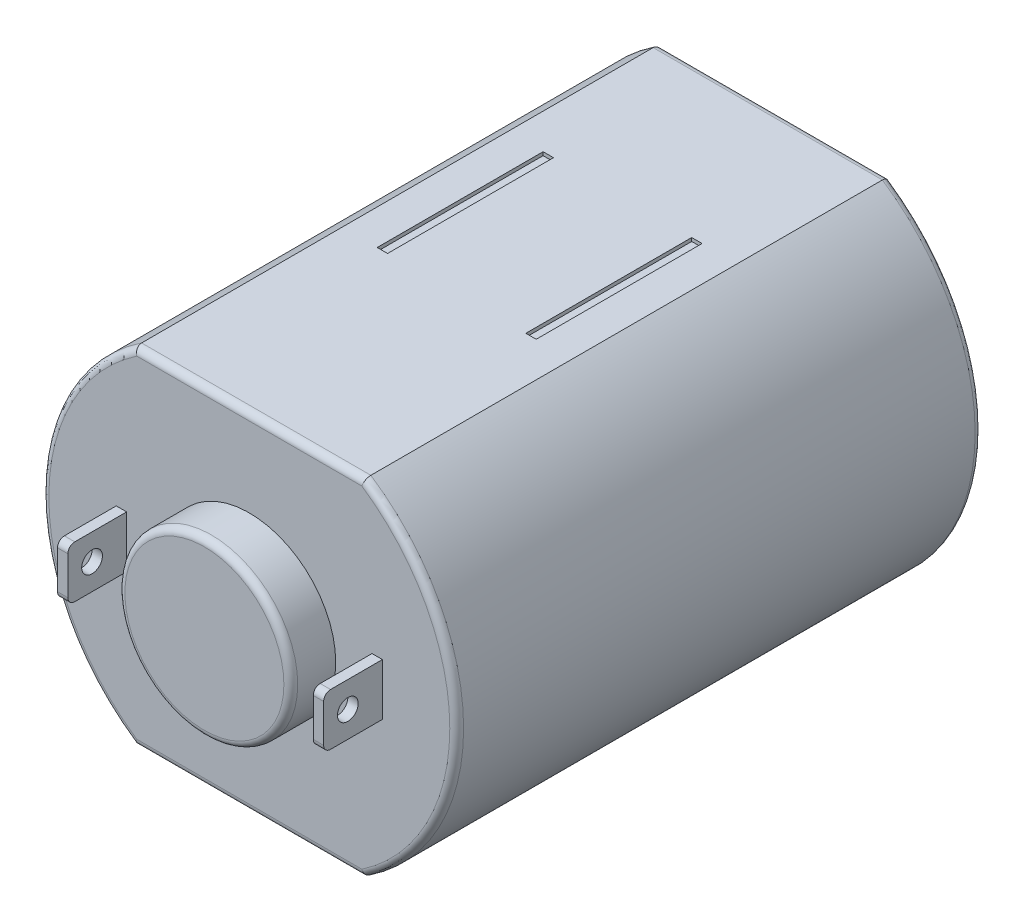
from build123d import *

# Parameters (mm, degrees)
AUFSATZ_LINEAR_AUSTRAGEN1_DEPTH = 15.2
SKIZZE2_R                       = 2.5
AUFSATZ_LINEAR_AUSTRAGEN2_DEPTH = 1.3
SKIZZE3_R                       = 0.5
AUFSATZ_LINEAR_AUSTRAGEN3_DEPTH = 2
VERRUNDUNG1_R                   = 0.2
SKIZZE4_W                       = 0.3
SKIZZE4_H                       = 4.8
SCHNITT_LINEAR_AUSTRAGEN1_DEPTH = 0.1
SKIZZE5_W                       = 0.3
SKIZZE5_H                       = 1.5
AUFSATZ_LINEAR_AUSTRAGEN4_DEPTH = 1.7
SCHNITT_LINEAR_AUSTRAGEN2_REACH = 22.19
SKIZZE6_R                       = 0.3
VERRUNDUNG2_R                   = 0.2


with BuildPart() as part:
    # Skizze1 → Aufsatz-Linear austragen1 (new body)
    with BuildSketch(Plane.XY):
        with BuildLine():
            Line((-3.31662479, 5), (3.31662479, 5))
            ThreePointArc((3.31662479, 5), (6, 0), (3.31662479, -5))
            Line((3.31662479, -5), (-3.31662479, -5))
            ThreePointArc((-3.31662479, -5), (-6, 0), (-3.31662479, 5))
        make_face()
    extrude(amount=AUFSATZ_LINEAR_AUSTRAGEN1_DEPTH)

    # Skizze2 → Aufsatz-Linear austragen2 (add)
    with BuildSketch(Plane.XY.offset(15.2)):
        Circle(SKIZZE2_R)
    extrude(amount=AUFSATZ_LINEAR_AUSTRAGEN2_DEPTH)

    # Skizze3 → Aufsatz-Linear austragen3 (add)
    with BuildSketch(Plane(origin=(0, 0, 0), x_dir=(-1, 0, 0), z_dir=(0, 0, -1))):
        Circle(SKIZZE3_R)
    extrude(amount=AUFSATZ_LINEAR_AUSTRAGEN3_DEPTH)

    # Verrundung1
    verrundung1_edges = [part.edges().sort_by_distance(p)[0] for p in [
        (-2.5, 0, 16.5),
        (0, 5, 15.2),
        (6, 0, 15.2),
        (0, -5, 15.2),
        (-6, 0, 15.2),
        (0, -5, 0),
        (-6, 0, 0),
        (0, 5, 0),
        (6, 0, 0),
    ]]
    fillet(verrundung1_edges, radius=VERRUNDUNG1_R)

    # Skizze4 → Schnitt-Linear austragen1 (cut)
    with BuildSketch(Plane(origin=(0, 5, 0), x_dir=(1, 0, 0), z_dir=(0, 1, 0))):
        with Locations((-2.15, -6.8)):
            Rectangle(SKIZZE4_W, SKIZZE4_H)
        with Locations((2.15, -6.8)):
            Rectangle(SKIZZE4_W, SKIZZE4_H)
    schnitt_linear_austragen1 = extrude(amount=-SCHNITT_LINEAR_AUSTRAGEN1_DEPTH, mode=Mode.SUBTRACT)

    # Spiegeln1: Schnitt-Linear austragen1 across plane
    add(schnitt_linear_austragen1.mirror(Plane.ZX), mode=Mode.SUBTRACT)

    # Skizze5 → Aufsatz-Linear austragen4 (add)
    with BuildSketch(Plane.XY.offset(15.2)):
        with Locations((-3.7, 0)):
            Rectangle(SKIZZE5_W, SKIZZE5_H)
        with Locations((3.7, 0)):
            Rectangle(SKIZZE5_W, SKIZZE5_H)
    extrude(amount=AUFSATZ_LINEAR_AUSTRAGEN4_DEPTH)

    # Skizze6 → Schnitt-Linear austragen2 (cut, up to next)
    with BuildSketch(Plane.ZY.offset(3.85), mode=Mode.PRIVATE) as schnitt_linear_austragen2_sk1:
        with Locations((16.2, 0)):
            Circle(SKIZZE6_R)
    schnitt_linear_austragen2_tool1 = extrude(schnitt_linear_austragen2_sk1.sketch, amount=-SCHNITT_LINEAR_AUSTRAGEN2_REACH, mode=Mode.PRIVATE) & part.part
    schnitt_linear_austragen2 = schnitt_linear_austragen2_tool1.solids().sort_by_distance((-3.85, 0, 16.2))[0]
    add(schnitt_linear_austragen2, mode=Mode.SUBTRACT)

    # Spiegeln6: Schnitt-Linear austragen2 across plane
    add(schnitt_linear_austragen2.mirror(Plane(origin=(0, 0, 0), x_dir=(0, 0, 1), z_dir=(1, 0, 0))), mode=Mode.SUBTRACT)

    # Verrundung2
    verrundung2_edges = [part.edges().sort_by_distance(p)[0] for p in [
        (-3.7, 0.75, 16.9),
        (-3.7, -0.75, 16.9),
        (3.7, -0.75, 16.9),
        (3.7, 0.75, 16.9),
    ]]
    fillet(verrundung2_edges, radius=VERRUNDUNG2_R)


solid = part.part
